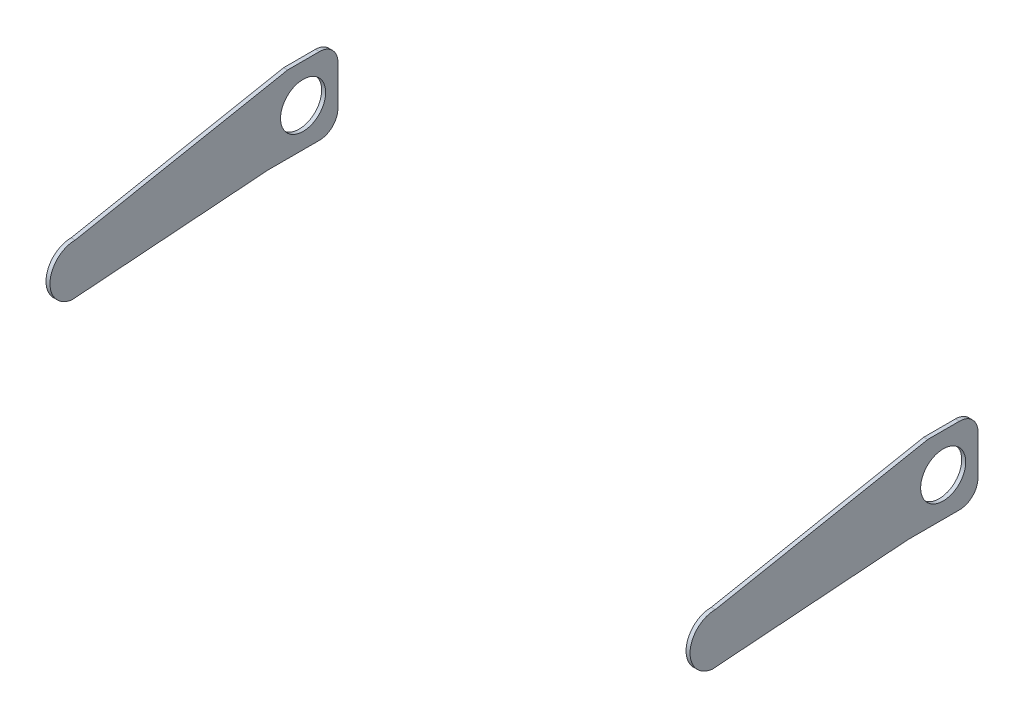
from build123d import *

# Parameters (mm, degrees)
SKETCH1_R           = 8.5
BOSS_EXTRUDE1_DEPTH = 1.5


with BuildPart() as part:
    # Sketch1 → Boss-Extrude1 (new body)
    with BuildSketch(Plane.ZY.offset(120)):
        with BuildLine():
            Line((12.127644035, -19.932837268), (-61.85712101, -14.5))
            Line((-61.85712101, -14.5), (-81.14287899, -14.5))
            ThreePointArc((-81.14287899, -14.5), (-86.092626458, -12.449747468), (-88.14287899, -7.5))
            Line((-88.14287899, -7.5), (-88.14287899, 7.5))
            ThreePointArc((-88.14287899, 7.5), (-86.092626458, 12.449747468), (-81.14287899, 14.5))
            Line((-81.14287899, 14.5), (-69.14287899, 14.5))
            Line((-69.14287899, 14.5), (11, -1))
            ThreePointArc((11, -1), (20.483194453, -9.935178811), (12.127644035, -19.932837268))
        make_face()
        with Locations((-75, 0)):
            Circle(SKETCH1_R, mode=Mode.SUBTRACT)
    extrude(amount=BOSS_EXTRUDE1_DEPTH)


with BuildPart() as body_2:
    # Mirror2: mirrored copy
    add(part.part.mirror(Plane(origin=(0, 0, 0), x_dir=(0, 0, 1), z_dir=(1, 0, 0))))


solid = Compound([part.part, body_2.part])
